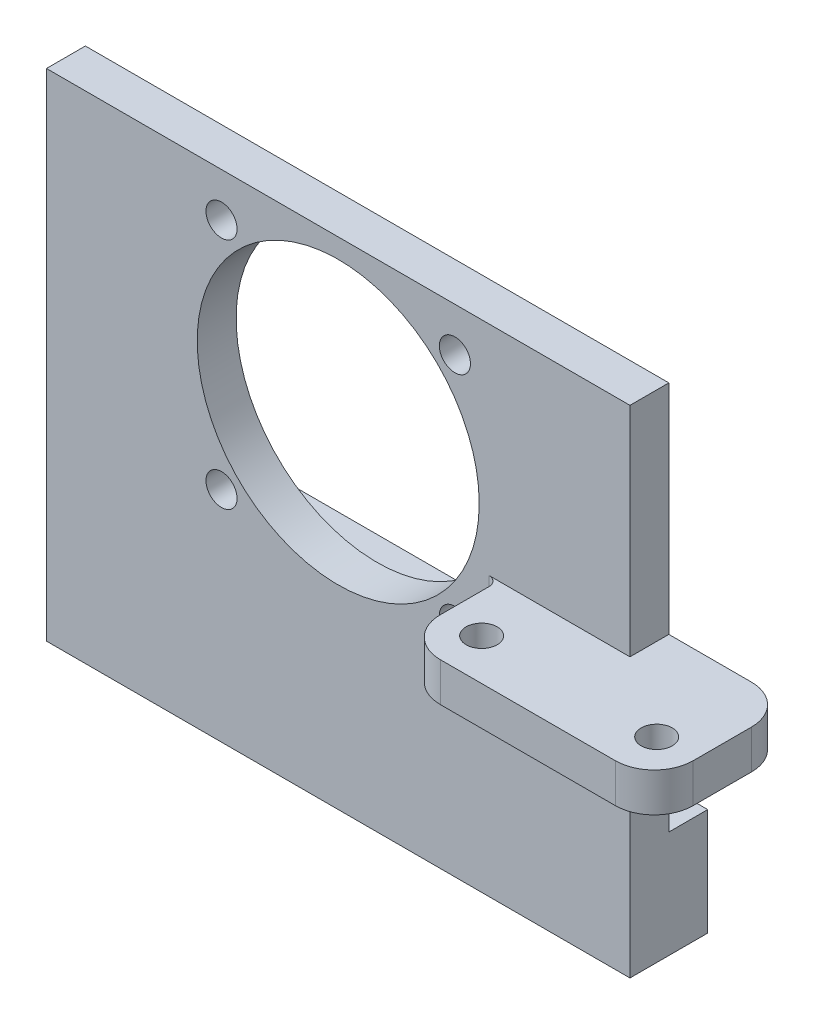
from build123d import *

# Parameters (mm, degrees)
SKETCH1_W           = 60
SKETCH1_H           = 40
BOSS_EXTRUDE1_DEPTH = 4
SKETCH4_R           = 14.5
CUT_EXTRUDE1_DEPTH  = 4
SKETCH6_R           = 1.6
CUT_EXTRUDE2_DEPTH  = 4
SKETCH7_W           = 26
SKETCH7_H           = 4
BOSS_EXTRUDE3_DEPTH = 10
SKETCH8_R           = 1.6
CUT_EXTRUDE3_DEPTH  = 78.162231694
SKETCH9_W           = 4
SKETCH9_H           = 4
BOSS_EXTRUDE4_DEPTH = 12.5
FILLET2_R           = 4
FILLET3_R           = 1
SKETCH10_W          = 60
SKETCH10_H          = 4
BOSS_EXTRUDE5_DEPTH = 11
BOSS_EXTRUDE6_DEPTH = 4
FILLET4_R           = 2
FILLET5_R           = 1
BOSS_EXTRUDE7_DEPTH = 4


with BuildPart() as part:
    # Sketch1 → Boss-Extrude1 (new body)
    with BuildSketch(Plane.XY):
        with Locations((30, 20)):
            Rectangle(SKETCH1_W, SKETCH1_H)
    extrude(amount=BOSS_EXTRUDE1_DEPTH)

    # Sketch4 → Cut-Extrude1 (cut)
    with BuildSketch(Plane.XY.offset(4)):
        with Locations((30, 23.5)):
            Circle(SKETCH4_R)
    extrude(amount=-CUT_EXTRUDE1_DEPTH, mode=Mode.SUBTRACT)

    # Sketch6 → Cut-Extrude2 (cut)
    with BuildSketch(Plane.XY.offset(4)):
        with Locations((42, 11.5)):
            Circle(SKETCH6_R)
        with Locations((18, 11.5)):
            Circle(SKETCH6_R)
        with Locations((18, 35.5)):
            Circle(SKETCH6_R)
        with Locations((42, 35.5)):
            Circle(SKETCH6_R)
    extrude(amount=-CUT_EXTRUDE2_DEPTH, mode=Mode.SUBTRACT)

    # Sketch7 → Boss-Extrude3 (add)
    with BuildSketch(Plane.XY.offset(4)):
        with Locations((59.5, 15.6)):
            Rectangle(SKETCH7_W, SKETCH7_H)
    extrude(amount=BOSS_EXTRUDE3_DEPTH)

    # Sketch8 → Cut-Extrude3 (cut, through all)
    with BuildSketch(Plane(origin=(0, 17.6, 0), x_dir=(1, 0, 0), z_dir=(0, 1, 0))):
        with Locations((68.5, -9.75)):
            Circle(SKETCH8_R)
        with Locations((50.5, -9.75)):
            Circle(SKETCH8_R)
    extrude(amount=-CUT_EXTRUDE3_DEPTH, mode=Mode.SUBTRACT)

    # Sketch9 → Boss-Extrude4 (add)
    with BuildSketch(Plane(origin=(60, 0, 0), x_dir=(0, 0, -1), z_dir=(1, 0, 0))):
        with Locations((-2, 15.6)):
            Rectangle(SKETCH9_W, SKETCH9_H)
    extrude(amount=BOSS_EXTRUDE4_DEPTH)

    # Fillet2
    fillet2_edges = [part.edges().sort_by_distance(p)[0] for p in [
        (72.5, 15.6, 14),
        (46.5, 15.6, 14),
        (72.5, 15.6, 0),
    ]]
    fillet(fillet2_edges, radius=FILLET2_R)

    # Fillet3
    fillet3_edges = [part.edges().sort_by_distance(p)[0] for p in [
        (60, 13.6, 2),
        (53.25, 13.6, 4),
        (46.5, 15.6, 4),
    ]]
    fillet(fillet3_edges, radius=FILLET3_R)

    # Sketch10 → Boss-Extrude5 (add)
    with BuildSketch(Plane.XZ):
        with Locations((30, 2)):
            Rectangle(SKETCH10_W, SKETCH10_H)
    extrude(amount=BOSS_EXTRUDE5_DEPTH)

    # Sketch11 → Boss-Extrude6 (add)
    with BuildSketch(Plane(origin=(0, 0, 0), x_dir=(-1, 0, 0), z_dir=(0, 0, -1))):
        with BuildLine():
            Line((-47.5, 10), (-60, 10))
            Line((-60, 10), (-60, 6))
            Line((-60, 6), (-41.120968606, 6))
            Line((-41.120968606, 6), (-40, 6))
            Line((-40, 6), (-20, 6))
            Line((-20, 6), (-18.879031394, 6))
            Line((-18.879031394, 6), (0, 6))
            Line((0, 6), (0, 10))
            Line((0, 10), (-12.5, 10))
            ThreePointArc((-12.5, 10), (-13.491446253, 8.630531665), (-14.748549011, 7.5))
            Line((-14.748549011, 7.5), (-45.251450989, 7.5))
            ThreePointArc((-45.251450989, 7.5), (-46.508553747, 8.630531665), (-47.5, 10))
        make_face()
    extrude(amount=BOSS_EXTRUDE6_DEPTH)

    # Fillet4
    fillet4_edges = [part.edges().sort_by_distance(p)[0] for p in [
        (47.5, 10, -2),
        (12.5, 10, -2),
        (45.251450989, 7.5, -2),
        (14.748549011, 7.5, -2),
    ]]
    fillet(fillet4_edges, radius=FILLET4_R)

    # Fillet5
    fillet5_edges = [part.edges().sort_by_distance(p)[0] for p in [
        (54.287595093, 10, 0),
        (47.678567849, 9.787755125, 0),
        (46.456976515, 8.57373675, 0),
        (45.26301591, 7.630923407, 0),
        (30, 7.5, 0),
        (14.73698409, 7.630923407, 0),
        (13.543023485, 8.57373675, 0),
        (12.321432151, 9.787755125, 0),
        (5.712404907, 10, 0),
    ]]
    fillet(fillet5_edges, radius=FILLET5_R)

    # Sketch13 → Boss-Extrude7 (add)
    with BuildSketch(Plane(origin=(0, 0, 0), x_dir=(-1, 0, 0), z_dir=(0, 0, -1))):
        with BuildLine():
            Line((-60, -11), (-60, 0))
            Line((-60, 0), (-39, 0))
            ThreePointArc((-39, 0), (-34.757359313, -1.757359313), (-33, -6))
            Line((-33, -6), (-33, -11))
            Line((-33, -11), (-60, -11))
        make_face()
        with BuildLine():
            Line((0, 0), (-21, 0))
            ThreePointArc((-21, 0), (-25.242640687, -1.757359313), (-27, -6))
            Line((-27, -6), (-27, -11))
            Line((-27, -11), (0, -11))
            Line((0, -11), (0, 0))
        make_face()
    extrude(amount=BOSS_EXTRUDE7_DEPTH)


solid = part.part
